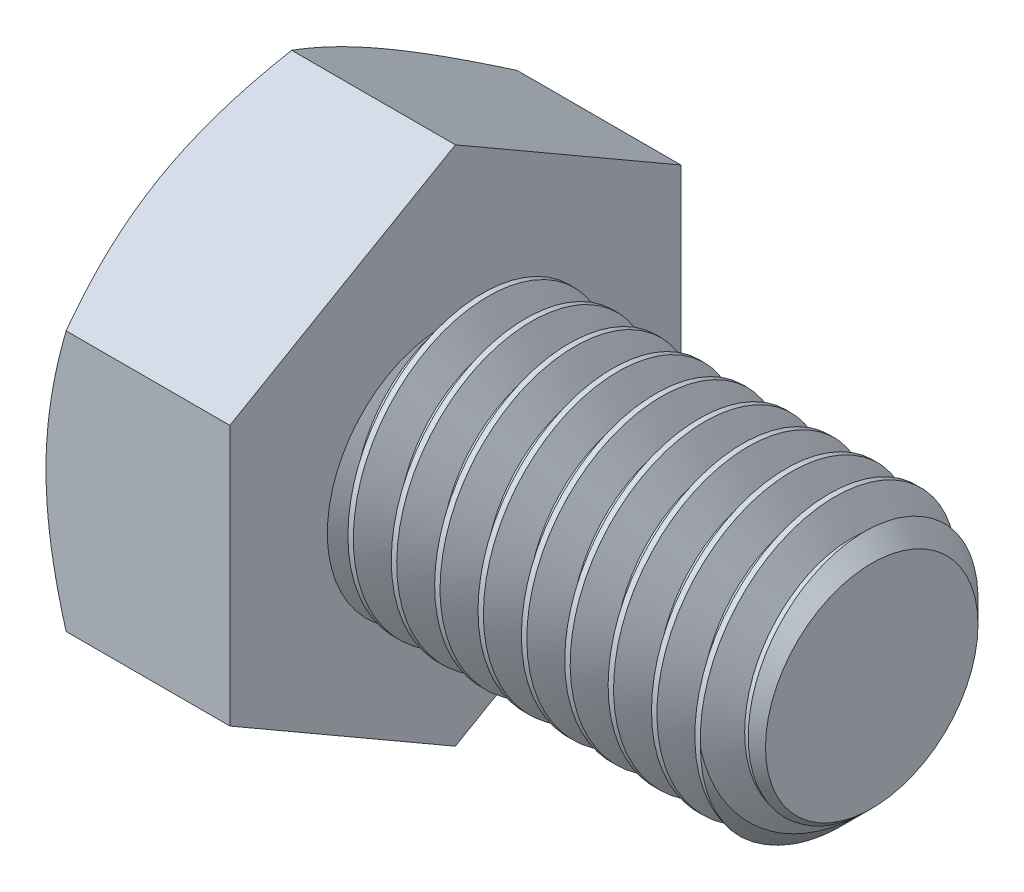
from build123d import *

# Parameters (mm, degrees)
SKETCH2_R           = 4
BOSS_EXTRUDE1_DEPTH = 12
CHAMFER1_SIZE       = 0.9375
CUT_SWEEP1_PITCH    = 1.25
BOSS_EXTRUDE2_DEPTH = 5.3
SKETCH6_OUTSIDE_W   = 92.83
SKETCH6_OUTSIDE_H   = 94.842
SKETCH6_OUTSIDE_R   = 6.5
CUT_EXTRUDE1_DEPTH  = 20.946762634
CUT_EXTRUDE1_DRAFT  = -60


with BuildPart() as part:
    # Sketch2 → Boss-Extrude1 (new body)
    with BuildSketch(Plane(origin=(8.65, 0, 0), x_dir=(0, 0, -1), z_dir=(1, 0, 0))):
        Circle(SKETCH2_R)
    extrude(amount=-BOSS_EXTRUDE1_DEPTH)

    # Chamfer1
    chamfer1_edges = [part.edges().sort_by_distance(p)[0] for p in [
        (8.65, 0, 4),
    ]]
    chamfer(chamfer1_edges, length=CHAMFER1_SIZE)

    # Cut-Sweep1: the profile of Sketch5 profile screwed along a right-hand helix of 10.6 turns, 8 arcs to a turn; built about Z, then put on its axis
    cut_sweep1_z = Axis((0, 0, 0), (0, 0, 1))
    cut_sweep1_corners = [(4.0003, 0, 0.000173205), (3.188101184, 0, -0.46875), (3.188101184, 0, -0.625), (4.0003, 0, -1.093923205)]
    with BuildLine(mode=Mode.PRIVATE) as cut_sweep1_profile:
        Line(cut_sweep1_corners[0], cut_sweep1_corners[1])
        Line(cut_sweep1_corners[1], cut_sweep1_corners[2])
        Line(cut_sweep1_corners[2], cut_sweep1_corners[3])
        Line(cut_sweep1_corners[3], cut_sweep1_corners[0])
    cut_sweep1_cap = Face(cut_sweep1_profile.wire())
    cut_sweep1_turn_angles = [0, 22.5, 45, 67.5, 90, 112.5, 135, 157.5, 180, 202.5, 225, 247.5, 270, 292.5, 315, 337.5, 360]
    cut_sweep1_turn_weights = [1, 0.9238795325112867, 1, 0.9238795325112867, 1, 0.9238795325112867, 1, 0.9238795325112867, 1, 0.9238795325112867, 1, 0.9238795325112867, 1, 0.9238795325112867, 1, 0.9238795325112867, 1]
    cut_sweep1_turn_rails = [Edge.make_bspline([Vector(p[0], p[1], 0).rotate(cut_sweep1_z, cut_sweep1_turn_angles[k]) / cut_sweep1_turn_weights[k] + Vector(0, 0, p[2] + CUT_SWEEP1_PITCH * cut_sweep1_turn_angles[k] / 360) for k in range(17)], [0, 0, 0, 1, 1, 2, 2, 3, 3, 4, 4, 5, 5, 6, 6, 7, 7, 8, 8, 8], 2, cut_sweep1_turn_weights) for p in cut_sweep1_corners]
    cut_sweep1_turn_sides = [Face.make_surface_from_curves(cut_sweep1_turn_rails[p[0]], cut_sweep1_turn_rails[p[1]]) for p in [(0, 1), (1, 2), (2, 3), (3, 0)]]
    cut_sweep1_last_angles = [3600, 3622.5, 3645, 3667.5, 3690, 3712.5, 3735, 3757.5, 3780, 3798, 3816]
    cut_sweep1_last_weights = [1, 0.9238795325112867, 1, 0.9238795325112867, 1, 0.9238795325112867, 1, 0.9238795325112867, 1, 0.9510565162950726, 1]
    cut_sweep1_last_rails = [Edge.make_bspline([Vector(p[0], p[1], 0).rotate(cut_sweep1_z, cut_sweep1_last_angles[k]) / cut_sweep1_last_weights[k] + Vector(0, 0, p[2] + CUT_SWEEP1_PITCH * cut_sweep1_last_angles[k] / 360) for k in range(11)], [0, 0, 0, 1, 1, 2, 2, 3, 3, 4, 4, 5, 5, 5], 2, cut_sweep1_last_weights) for p in cut_sweep1_corners]
    cut_sweep1_last_sides = [Face.make_surface_from_curves(cut_sweep1_last_rails[p[0]], cut_sweep1_last_rails[p[1]]) for p in [(0, 1), (1, 2), (2, 3), (3, 0)]]
    cut_sweep1 = Plane(origin=(8.65, 0, 0), x_dir=(0, 1, 0), z_dir=(-1, 0, 0)) * Solid(Shell([*[p.moved(Location((0, 0, CUT_SWEEP1_PITCH * i))) for i in range(10) for p in cut_sweep1_turn_sides], *cut_sweep1_last_sides, cut_sweep1_cap, cut_sweep1_cap.rotate(cut_sweep1_z, 3816).moved(Location((0, 0, CUT_SWEEP1_PITCH * 3816 / 360)))]))
    add(cut_sweep1, mode=Mode.SUBTRACT)

    # Sketch3 → Boss-Extrude2 (add)
    with BuildSketch(Plane.ZY.offset(3.35)):
        Polygon((-6.5, -3.75277675), (0, -7.505553499), (6.5, -3.75277675), (6.5, 3.75277675), (0, 7.505553499), (-6.5, 3.75277675), align=None)
    extrude(amount=BOSS_EXTRUDE2_DEPTH)


with BuildPart() as cut_extrude1_tool:
    # Sketch6 outside → Cut-Extrude1 (with draft: the straight prism first)
    with BuildSketch(Plane.ZY.offset(8.65)):
        Rectangle(SKETCH6_OUTSIDE_W, SKETCH6_OUTSIDE_H)
        Circle(SKETCH6_OUTSIDE_R, mode=Mode.SUBTRACT)
    extrude(amount=-CUT_EXTRUDE1_DEPTH)
    # Cut-Extrude1: the draft: its side faces are tilted about the plane it starts from
    cut_extrude1_sides = [cut_extrude1_tool.faces().sort_by_distance(p)[0] for p in [
        (1.823381317, -47.421, 0),
        (1.823381317, 0, 46.415),
        (1.823381317, 47.421, 0),
        (1.823381317, 0, -46.415),
        (1.823381317, 0, -6.5),
    ]]
    draft(cut_extrude1_sides, Plane.ZY.offset(8.65), CUT_EXTRUDE1_DRAFT)


with BuildPart() as part_1:
    add(part.part)

    # Cut-Extrude1: cut by cut_extrude1_tool
    add(cut_extrude1_tool.part, mode=Mode.SUBTRACT)


solid = part_1.part
